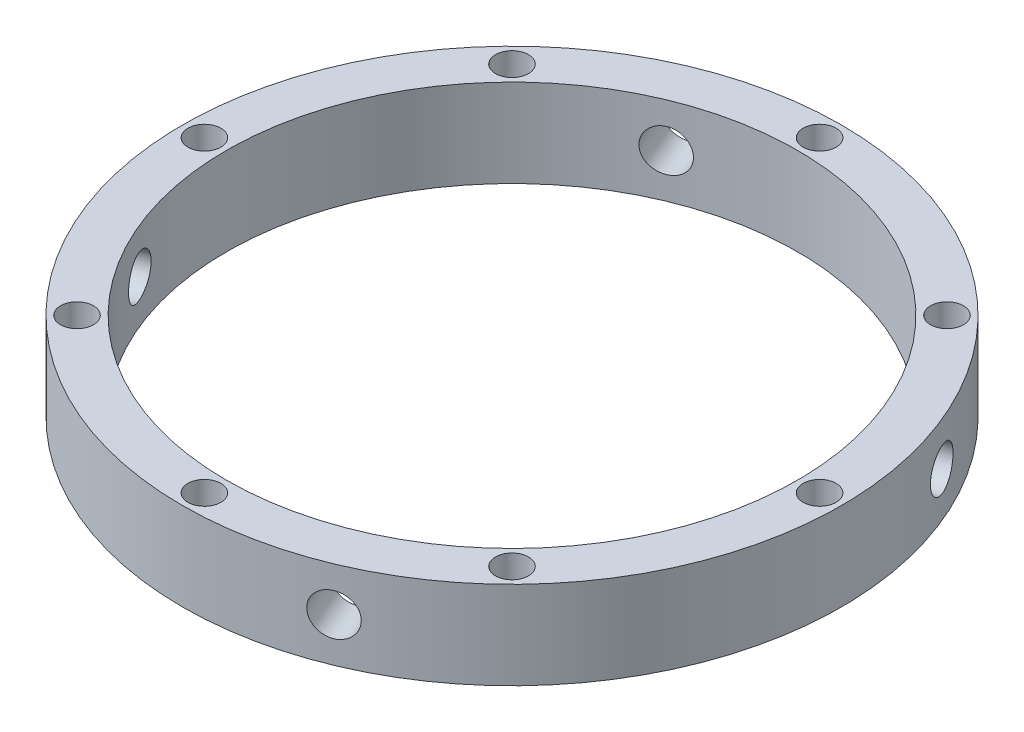
from build123d import *

# Parameters (mm, degrees)
EXTRUDE_1_OUTLINE_R      = 30
EXTRUDE_1_OUTLINE_R_2    = 1.5
EXTRUDE_1_OUTLINE_R_3    = 26
EXTRUDE_1_DEPTH          = 8
CUT_EXTRUDE_1_DEPTH      = 44.17406629
CUT_EXTRUDE_1_DEPTH_BACK = 44.17406629
CUT_EXTRUDE_2_DEPTH      = 44.174066447
CUT_EXTRUDE_2_DEPTH_BACK = 44.174066447
SKETCH_5_R               = 1.9


# Read off the part's stored shape, not the designer's step: 凸台-拉伸1
with BuildPart() as part:
    # 凸台-拉伸1 outline → 凸台-拉伸1 (new body)
    with BuildSketch(Plane(origin=(0, 0, 0), x_dir=(1, 0, 0), z_dir=(0, 1, 0))):
        Circle(EXTRUDE_1_OUTLINE_R)
        with Locations((-19.798989873, -19.798989873)):
            Circle(EXTRUDE_1_OUTLINE_R_2, mode=Mode.SUBTRACT)
        with Locations((0, -28)):
            Circle(EXTRUDE_1_OUTLINE_R_2, mode=Mode.SUBTRACT)
        with Locations((19.798989873, -19.798989873)):
            Circle(EXTRUDE_1_OUTLINE_R_2, mode=Mode.SUBTRACT)
        with Locations((-28, 0)):
            Circle(EXTRUDE_1_OUTLINE_R_2, mode=Mode.SUBTRACT)
        with Locations((-19.798989873, 19.798989873)):
            Circle(EXTRUDE_1_OUTLINE_R_2, mode=Mode.SUBTRACT)
        Circle(EXTRUDE_1_OUTLINE_R_3, mode=Mode.SUBTRACT)
        with Locations((28, 0)):
            Circle(EXTRUDE_1_OUTLINE_R_2, mode=Mode.SUBTRACT)
        with Locations((0, 28)):
            Circle(EXTRUDE_1_OUTLINE_R_2, mode=Mode.SUBTRACT)
        with Locations((19.798989873, 19.798989873)):
            Circle(EXTRUDE_1_OUTLINE_R_2, mode=Mode.SUBTRACT)
    extrude(amount=EXTRUDE_1_DEPTH)

    # 草图4 → 切除-拉伸1 (cut, two sides: drawn at the far end of the back side and taken through both)
    with BuildSketch(Plane(origin=(0, 0, 0), x_dir=(-0.38268343236509067, 0, -0.9238795325112864), z_dir=(0.9238795325112864, 0, -0.38268343236509067)).offset(-CUT_EXTRUDE_1_DEPTH_BACK)):
        with BuildLine():
            ThreePointArc((0, 5.9), (-1.9, 4), (0, 2.1))
            Line((0, 2.1), (0, 5.9))
        make_face()
        with BuildLine():
            Line((0, 5.9), (0, 2.1))
            ThreePointArc((0, 2.1), (1.343502884, 2.656497116), (1.9, 4))
            ThreePointArc((1.9, 4), (1.343502884, 5.343502884), (0, 5.9))
        make_face()
    extrude(amount=CUT_EXTRUDE_1_DEPTH + CUT_EXTRUDE_1_DEPTH_BACK, mode=Mode.SUBTRACT)

    # 草图5 → 切除-拉伸2 (cut, two sides: drawn at the far end of the back side and taken through both)
    with BuildSketch(Plane(origin=(0, 0, 0), x_dir=(0.9238795325112864, 0, -0.3826834323650906), z_dir=(0.3826834323650906, 0, 0.9238795325112864)).offset(-CUT_EXTRUDE_2_DEPTH_BACK)):
        with Locations((0, 4)):
            Circle(SKETCH_5_R)
    extrude(amount=CUT_EXTRUDE_2_DEPTH + CUT_EXTRUDE_2_DEPTH_BACK, mode=Mode.SUBTRACT)


solid = part.part
